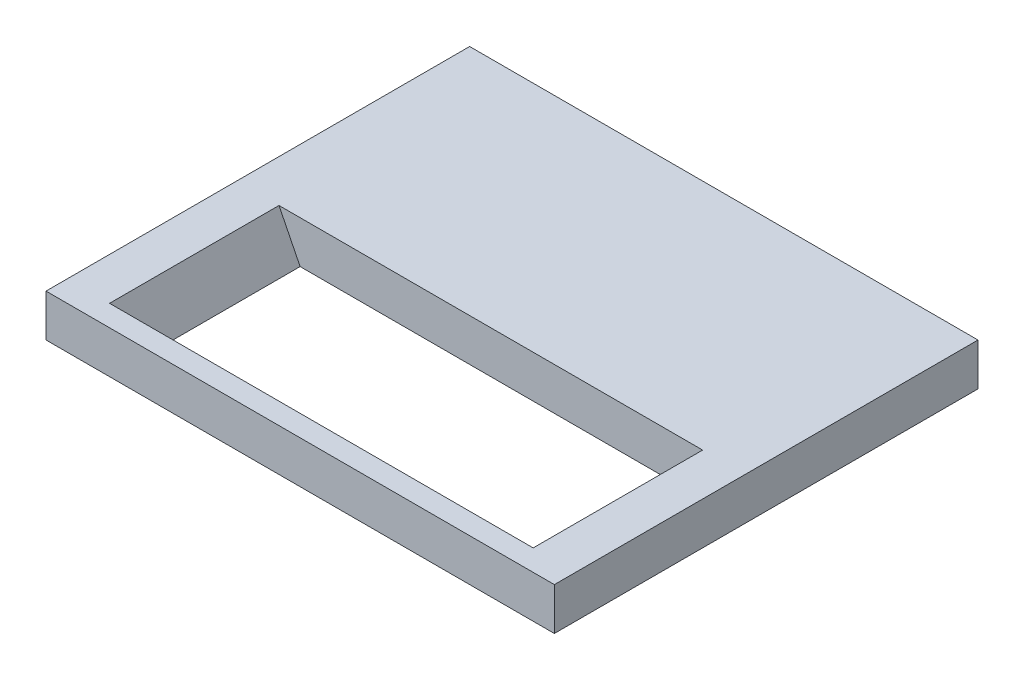
from build123d import *

# Parameters (mm, degrees)
BOSS_EXTRUDE1_DEPTH = 10
SKETCH2_W           = 90
SKETCH2_H           = 40
CUT_EXTRUDE1_DEPTH  = 10
SKETCH2_3_W         = 3
SKETCH2_3_H         = 3
SKETCH2_3_W_2       = 6
SKETCH2_3_H_2       = 6
CUT_EXTRUDE2_DEPTH  = 6
CHAMFER2_SIZE       = 5
CHAMFER2_SIZE_2     = 10.028448541
CHAMFER3_SIZE2      = 4.999988835
CHAMFER3_SIZE       = 10


# Some blends are built 0.0001 mm under size
with BuildPart() as part:
    # Sketch1 → Boss-Extrude1 (new body)
    with BuildSketch(Plane(origin=(0, 0, 0), x_dir=(1, 0, 0), z_dir=(0, 1, 0))):
        Polygon((-60, 50), (-60, -2.5), (-60, -50), (0, -50), (60, -50), (60, 50), (0, 50), align=None)
    extrude(amount=-BOSS_EXTRUDE1_DEPTH)

    # Sketch2 → Cut-Extrude1 (cut)
    with BuildSketch(Plane.XZ.offset(10)):
        with Locations((0, 25)):
            Rectangle(SKETCH2_W, SKETCH2_H)
    extrude(amount=-CUT_EXTRUDE1_DEPTH, mode=Mode.SUBTRACT)

    # Sketch2<3> → Cut-Extrude2 (cut)
    with BuildSketch(Plane.XZ.offset(10)):
        with Locations((47.5, 47.5)):
            Rectangle(SKETCH2_3_W, SKETCH2_3_H)
        with Locations((-47.5, 2.5)):
            Rectangle(SKETCH2_3_W, SKETCH2_3_H)
        with Locations((47.5, 2.5)):
            Rectangle(SKETCH2_3_W, SKETCH2_3_H)
        with Locations((45, -25)):
            Rectangle(SKETCH2_3_W_2, SKETCH2_3_H_2)
        with Locations((-47.5, 47.5)):
            Rectangle(SKETCH2_3_W, SKETCH2_3_H)
        with Locations((-45, -25)):
            Rectangle(SKETCH2_3_W_2, SKETCH2_3_H_2)
    extrude(amount=-CUT_EXTRUDE2_DEPTH, mode=Mode.SUBTRACT)

    # Chamfer2
    # the kernel refuses this chamfer: 10.028448541, 5 mm, written as the material it takes off along each edge
    with BuildSketch(Plane(origin=(-45, 0, 5), x_dir=(-0.9976061957759285, 0.06915112543899754, 0), z_dir=(0, 0, 1))) as chamfer2_piece_1:
        Polygon((CHAMFER2_SIZE * 0.997606195776, CHAMFER2_SIZE * 0.069151125439), (-CHAMFER2_SIZE_2 * 0.069151125441, CHAMFER2_SIZE_2 * 0.997606195805), (0, 0), align=None)
    extrude(amount=40, mode=Mode.SUBTRACT)

    # Chamfer3
    chamfer3_edges = [part.edges().sort_by_distance(p)[0] for p in [
        (45, 0, 25),
    ]]
    chamfer3_side = [part.faces().sort_by_distance(p)[0] for p in [
        (45, -0.099999777, 25),
    ]]
    chamfer(chamfer3_edges, length=CHAMFER3_SIZE - 0.0001, length2=CHAMFER3_SIZE2 - 0.0001, reference=chamfer3_side[0])  # a hair under: the kernel refuses the full size


solid = part.part
